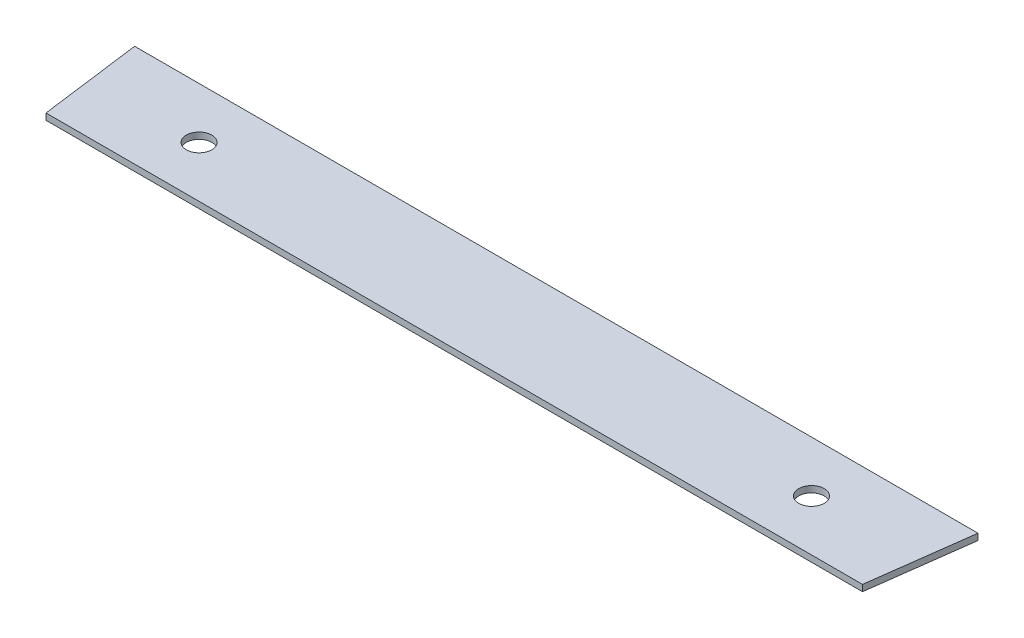
from build123d import *

# Parameters (mm, degrees)
SKETCH1_R           = 6.35
BOSS_EXTRUDE1_DEPTH = 3.175


with BuildPart() as part:
    # Sketch1 → Boss-Extrude1 (new body)
    with BuildSketch(Plane(origin=(0, 0, 0), x_dir=(1, 0, 0), z_dir=(0, 1, 0))):
        Polygon((-203.2, -25.4), (203.2, -25.4), (209.887946877, 25.4), (-209.887946877, 25.4), align=None)
        with Locations((-152.4, 0)):
            Circle(SKETCH1_R, mode=Mode.SUBTRACT)
        with Locations((152.4, 0)):
            Circle(SKETCH1_R, mode=Mode.SUBTRACT)
    extrude(amount=BOSS_EXTRUDE1_DEPTH)


solid = part.part
